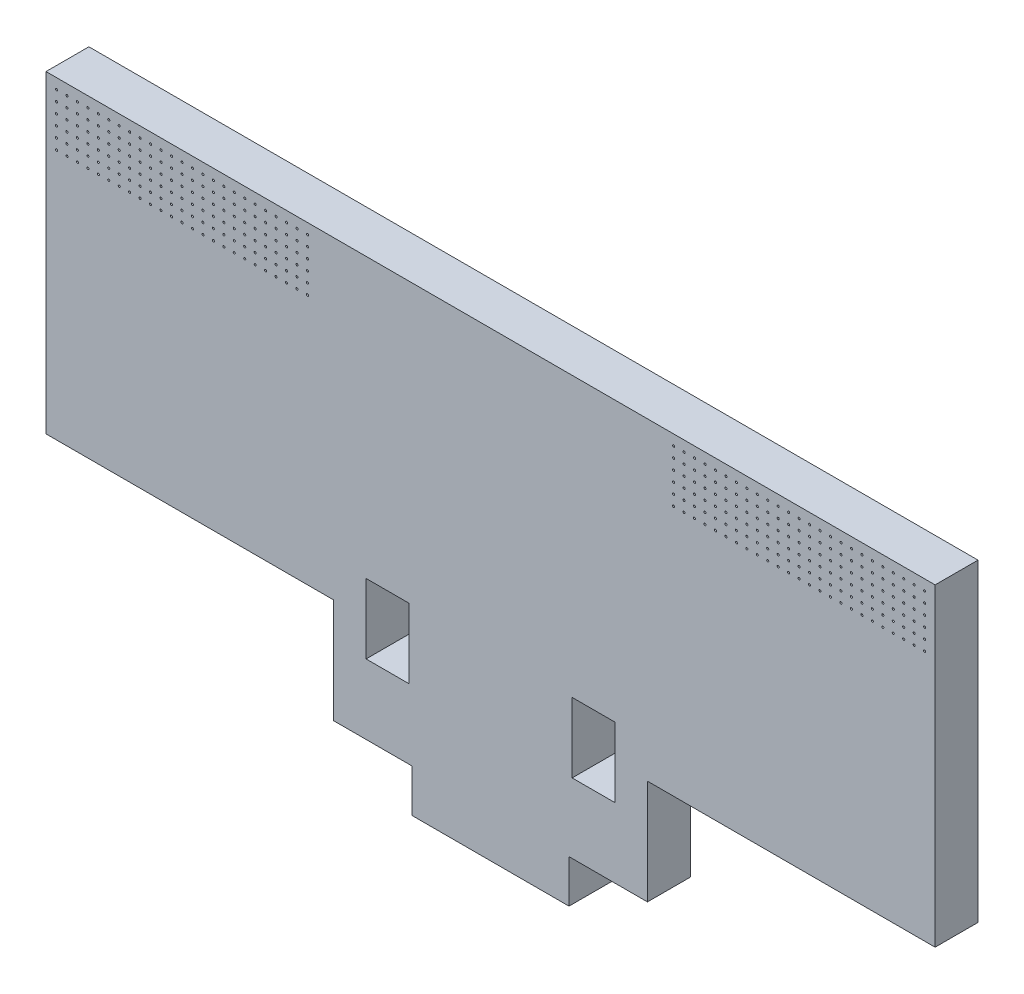
from build123d import *

# Parameters (mm, degrees)
BOSS_EXTRUDE1_DEPTH = 5.207
SKETCH2_R           = 0.127
CUT_EXTRUDE1_DEPTH  = 120.419241955
CAVITY1_START       = 8.466666667
CAVITY1_OUTLINE_W   = 5.207
CAVITY1_OUTLINE_H   = 5.207
CAVITY1_DEPTH       = 8.466666666
SKETCH3_W           = 34.925
SKETCH3_H           = 12.7
CUT_EXTRUDE2_DEPTH  = 120.419241955


# Read off the part's stored shape, not the designer's step: Cavity1
with BuildPart() as part:
    # Sketch1 → Boss-Extrude1 (new body)
    with BuildSketch(Plane.XY):
        Polygon((63.5, 0), (107.95, 0), (107.95, 50.8), (0, 50.8), (0, 0), (44.45, 0), (44.45, -5.207), (63.5, -5.207), align=None)
    extrude(amount=BOSS_EXTRUDE1_DEPTH)

    # Sketch2 → Cut-Extrude1 (cut, through all)
    with BuildSketch(Plane.XY.offset(5.207)):
        with Locations((106.68, 49.53)):
            Circle(SKETCH2_R)
        with Locations((105.41, 49.53)):
            Circle(SKETCH2_R)
        with Locations((104.14, 49.53)):
            Circle(SKETCH2_R)
        with Locations((102.87, 49.53)):
            Circle(SKETCH2_R)
        with Locations((101.6, 49.53)):
            Circle(SKETCH2_R)
        with Locations((100.33, 49.53)):
            Circle(SKETCH2_R)
        with Locations((99.06, 49.53)):
            Circle(SKETCH2_R)
        with Locations((97.79, 49.53)):
            Circle(SKETCH2_R)
        with Locations((96.52, 49.53)):
            Circle(SKETCH2_R)
        with Locations((95.25, 49.53)):
            Circle(SKETCH2_R)
        with Locations((93.98, 49.53)):
            Circle(SKETCH2_R)
        with Locations((92.71, 49.53)):
            Circle(SKETCH2_R)
        with Locations((91.44, 49.53)):
            Circle(SKETCH2_R)
        with Locations((90.17, 49.53)):
            Circle(SKETCH2_R)
        with Locations((88.9, 49.53)):
            Circle(SKETCH2_R)
        with Locations((87.63, 49.53)):
            Circle(SKETCH2_R)
        with Locations((86.36, 49.53)):
            Circle(SKETCH2_R)
        with Locations((85.09, 49.53)):
            Circle(SKETCH2_R)
        with Locations((83.82, 49.53)):
            Circle(SKETCH2_R)
        with Locations((82.55, 49.53)):
            Circle(SKETCH2_R)
        with Locations((81.28, 49.53)):
            Circle(SKETCH2_R)
        with Locations((80.01, 49.53)):
            Circle(SKETCH2_R)
        with Locations((78.74, 49.53)):
            Circle(SKETCH2_R)
        with Locations((77.47, 49.53)):
            Circle(SKETCH2_R)
        with Locations((76.2, 49.53)):
            Circle(SKETCH2_R)
        with Locations((105.41, 48.26)):
            Circle(SKETCH2_R)
        with Locations((104.14, 48.26)):
            Circle(SKETCH2_R)
        with Locations((102.87, 48.26)):
            Circle(SKETCH2_R)
        with Locations((101.6, 48.26)):
            Circle(SKETCH2_R)
        with Locations((100.33, 48.26)):
            Circle(SKETCH2_R)
        with Locations((99.06, 48.26)):
            Circle(SKETCH2_R)
        with Locations((97.79, 48.26)):
            Circle(SKETCH2_R)
        with Locations((96.52, 48.26)):
            Circle(SKETCH2_R)
        with Locations((95.25, 48.26)):
            Circle(SKETCH2_R)
        with Locations((93.98, 48.26)):
            Circle(SKETCH2_R)
        with Locations((92.71, 48.26)):
            Circle(SKETCH2_R)
        with Locations((91.44, 48.26)):
            Circle(SKETCH2_R)
        with Locations((90.17, 48.26)):
            Circle(SKETCH2_R)
        with Locations((88.9, 48.26)):
            Circle(SKETCH2_R)
        with Locations((87.63, 48.26)):
            Circle(SKETCH2_R)
        with Locations((86.36, 48.26)):
            Circle(SKETCH2_R)
        with Locations((85.09, 48.26)):
            Circle(SKETCH2_R)
        with Locations((83.82, 48.26)):
            Circle(SKETCH2_R)
        with Locations((82.55, 48.26)):
            Circle(SKETCH2_R)
        with Locations((81.28, 48.26)):
            Circle(SKETCH2_R)
        with Locations((80.01, 48.26)):
            Circle(SKETCH2_R)
        with Locations((78.74, 48.26)):
            Circle(SKETCH2_R)
        with Locations((77.47, 48.26)):
            Circle(SKETCH2_R)
        with Locations((76.2, 48.26)):
            Circle(SKETCH2_R)
        with Locations((105.41, 46.99)):
            Circle(SKETCH2_R)
        with Locations((104.14, 46.99)):
            Circle(SKETCH2_R)
        with Locations((102.87, 46.99)):
            Circle(SKETCH2_R)
        with Locations((101.6, 46.99)):
            Circle(SKETCH2_R)
        with Locations((100.33, 46.99)):
            Circle(SKETCH2_R)
        with Locations((99.06, 46.99)):
            Circle(SKETCH2_R)
        with Locations((97.79, 46.99)):
            Circle(SKETCH2_R)
        with Locations((96.52, 46.99)):
            Circle(SKETCH2_R)
        with Locations((95.25, 46.99)):
            Circle(SKETCH2_R)
        with Locations((93.98, 46.99)):
            Circle(SKETCH2_R)
        with Locations((92.71, 46.99)):
            Circle(SKETCH2_R)
        with Locations((91.44, 46.99)):
            Circle(SKETCH2_R)
        with Locations((90.17, 46.99)):
            Circle(SKETCH2_R)
        with Locations((88.9, 46.99)):
            Circle(SKETCH2_R)
        with Locations((87.63, 46.99)):
            Circle(SKETCH2_R)
        with Locations((86.36, 46.99)):
            Circle(SKETCH2_R)
        with Locations((85.09, 46.99)):
            Circle(SKETCH2_R)
        with Locations((83.82, 46.99)):
            Circle(SKETCH2_R)
        with Locations((82.55, 46.99)):
            Circle(SKETCH2_R)
        with Locations((81.28, 46.99)):
            Circle(SKETCH2_R)
        with Locations((80.01, 46.99)):
            Circle(SKETCH2_R)
        with Locations((78.74, 46.99)):
            Circle(SKETCH2_R)
        with Locations((77.47, 46.99)):
            Circle(SKETCH2_R)
        with Locations((76.2, 46.99)):
            Circle(SKETCH2_R)
        with Locations((105.41, 45.72)):
            Circle(SKETCH2_R)
        with Locations((104.14, 45.72)):
            Circle(SKETCH2_R)
        with Locations((102.87, 45.72)):
            Circle(SKETCH2_R)
        with Locations((101.6, 45.72)):
            Circle(SKETCH2_R)
        with Locations((100.33, 45.72)):
            Circle(SKETCH2_R)
        with Locations((99.06, 45.72)):
            Circle(SKETCH2_R)
        with Locations((97.79, 45.72)):
            Circle(SKETCH2_R)
        with Locations((96.52, 45.72)):
            Circle(SKETCH2_R)
        with Locations((95.25, 45.72)):
            Circle(SKETCH2_R)
        with Locations((93.98, 45.72)):
            Circle(SKETCH2_R)
        with Locations((92.71, 45.72)):
            Circle(SKETCH2_R)
        with Locations((91.44, 45.72)):
            Circle(SKETCH2_R)
        with Locations((90.17, 45.72)):
            Circle(SKETCH2_R)
        with Locations((88.9, 45.72)):
            Circle(SKETCH2_R)
        with Locations((87.63, 45.72)):
            Circle(SKETCH2_R)
        with Locations((86.36, 45.72)):
            Circle(SKETCH2_R)
        with Locations((85.09, 45.72)):
            Circle(SKETCH2_R)
        with Locations((83.82, 45.72)):
            Circle(SKETCH2_R)
        with Locations((82.55, 45.72)):
            Circle(SKETCH2_R)
        with Locations((81.28, 45.72)):
            Circle(SKETCH2_R)
        with Locations((80.01, 45.72)):
            Circle(SKETCH2_R)
        with Locations((78.74, 45.72)):
            Circle(SKETCH2_R)
        with Locations((77.47, 45.72)):
            Circle(SKETCH2_R)
        with Locations((76.2, 45.72)):
            Circle(SKETCH2_R)
        with Locations((105.41, 44.45)):
            Circle(SKETCH2_R)
        with Locations((104.14, 44.45)):
            Circle(SKETCH2_R)
        with Locations((102.87, 44.45)):
            Circle(SKETCH2_R)
        with Locations((101.6, 44.45)):
            Circle(SKETCH2_R)
        with Locations((100.33, 44.45)):
            Circle(SKETCH2_R)
        with Locations((99.06, 44.45)):
            Circle(SKETCH2_R)
        with Locations((97.79, 44.45)):
            Circle(SKETCH2_R)
        with Locations((96.52, 44.45)):
            Circle(SKETCH2_R)
        with Locations((95.25, 44.45)):
            Circle(SKETCH2_R)
        with Locations((93.98, 44.45)):
            Circle(SKETCH2_R)
        with Locations((92.71, 44.45)):
            Circle(SKETCH2_R)
        with Locations((91.44, 44.45)):
            Circle(SKETCH2_R)
        with Locations((90.17, 44.45)):
            Circle(SKETCH2_R)
        with Locations((88.9, 44.45)):
            Circle(SKETCH2_R)
        with Locations((87.63, 44.45)):
            Circle(SKETCH2_R)
        with Locations((86.36, 44.45)):
            Circle(SKETCH2_R)
        with Locations((85.09, 44.45)):
            Circle(SKETCH2_R)
        with Locations((83.82, 44.45)):
            Circle(SKETCH2_R)
        with Locations((82.55, 44.45)):
            Circle(SKETCH2_R)
        with Locations((81.28, 44.45)):
            Circle(SKETCH2_R)
        with Locations((80.01, 44.45)):
            Circle(SKETCH2_R)
        with Locations((78.74, 44.45)):
            Circle(SKETCH2_R)
        with Locations((77.47, 44.45)):
            Circle(SKETCH2_R)
        with Locations((76.2, 44.45)):
            Circle(SKETCH2_R)
        with Locations((105.41, 43.18)):
            Circle(SKETCH2_R)
        with Locations((104.14, 43.18)):
            Circle(SKETCH2_R)
        with Locations((102.87, 43.18)):
            Circle(SKETCH2_R)
        with Locations((101.6, 43.18)):
            Circle(SKETCH2_R)
        with Locations((100.33, 43.18)):
            Circle(SKETCH2_R)
        with Locations((99.06, 43.18)):
            Circle(SKETCH2_R)
        with Locations((97.79, 43.18)):
            Circle(SKETCH2_R)
        with Locations((96.52, 43.18)):
            Circle(SKETCH2_R)
        with Locations((95.25, 43.18)):
            Circle(SKETCH2_R)
        with Locations((93.98, 43.18)):
            Circle(SKETCH2_R)
        with Locations((92.71, 43.18)):
            Circle(SKETCH2_R)
        with Locations((91.44, 43.18)):
            Circle(SKETCH2_R)
        with Locations((90.17, 43.18)):
            Circle(SKETCH2_R)
        with Locations((88.9, 43.18)):
            Circle(SKETCH2_R)
        with Locations((87.63, 43.18)):
            Circle(SKETCH2_R)
        with Locations((86.36, 43.18)):
            Circle(SKETCH2_R)
        with Locations((85.09, 43.18)):
            Circle(SKETCH2_R)
        with Locations((83.82, 43.18)):
            Circle(SKETCH2_R)
        with Locations((82.55, 43.18)):
            Circle(SKETCH2_R)
        with Locations((81.28, 43.18)):
            Circle(SKETCH2_R)
        with Locations((80.01, 43.18)):
            Circle(SKETCH2_R)
        with Locations((78.74, 43.18)):
            Circle(SKETCH2_R)
        with Locations((77.47, 43.18)):
            Circle(SKETCH2_R)
        with Locations((76.2, 43.18)):
            Circle(SKETCH2_R)
        with Locations((106.68, 48.26)):
            Circle(SKETCH2_R)
        with Locations((106.68, 46.99)):
            Circle(SKETCH2_R)
        with Locations((106.68, 45.72)):
            Circle(SKETCH2_R)
        with Locations((106.68, 44.45)):
            Circle(SKETCH2_R)
        with Locations((106.68, 43.18)):
            Circle(SKETCH2_R)
        with Locations(Location((1.27, 43.18, 0), (0, 0, 180))):
            Circle(SKETCH2_R)
        with Locations(Location((1.27, 44.45, 0), (0, 0, 180))):
            Circle(SKETCH2_R)
        with Locations(Location((1.27, 45.72, 0), (0, 0, 180))):
            Circle(SKETCH2_R)
        with Locations(Location((1.27, 46.99, 0), (0, 0, 180))):
            Circle(SKETCH2_R)
        with Locations(Location((1.27, 48.26, 0), (0, 0, 180))):
            Circle(SKETCH2_R)
        with Locations(Location((31.75, 43.18, 0), (0, 0, 180))):
            Circle(SKETCH2_R)
        with Locations(Location((30.48, 43.18, 0), (0, 0, 180))):
            Circle(SKETCH2_R)
        with Locations(Location((29.21, 43.18, 0), (0, 0, 180))):
            Circle(SKETCH2_R)
        with Locations(Location((27.94, 43.18, 0), (0, 0, 180))):
            Circle(SKETCH2_R)
        with Locations(Location((26.67, 43.18, 0), (0, 0, 180))):
            Circle(SKETCH2_R)
        with Locations(Location((25.4, 43.18, 0), (0, 0, 180))):
            Circle(SKETCH2_R)
        with Locations(Location((24.13, 43.18, 0), (0, 0, 180))):
            Circle(SKETCH2_R)
        with Locations(Location((22.86, 43.18, 0), (0, 0, 180))):
            Circle(SKETCH2_R)
        with Locations(Location((21.59, 43.18, 0), (0, 0, 180))):
            Circle(SKETCH2_R)
        with Locations(Location((20.32, 43.18, 0), (0, 0, 180))):
            Circle(SKETCH2_R)
        with Locations(Location((19.05, 43.18, 0), (0, 0, 180))):
            Circle(SKETCH2_R)
        with Locations(Location((17.78, 43.18, 0), (0, 0, 180))):
            Circle(SKETCH2_R)
        with Locations(Location((16.51, 43.18, 0), (0, 0, 180))):
            Circle(SKETCH2_R)
        with Locations(Location((15.24, 43.18, 0), (0, 0, 180))):
            Circle(SKETCH2_R)
        with Locations(Location((13.97, 43.18, 0), (0, 0, 180))):
            Circle(SKETCH2_R)
        with Locations(Location((12.7, 43.18, 0), (0, 0, 180))):
            Circle(SKETCH2_R)
        with Locations(Location((11.43, 43.18, 0), (0, 0, 180))):
            Circle(SKETCH2_R)
        with Locations(Location((10.16, 43.18, 0), (0, 0, 180))):
            Circle(SKETCH2_R)
        with Locations(Location((8.89, 43.18, 0), (0, 0, 180))):
            Circle(SKETCH2_R)
        with Locations(Location((7.62, 43.18, 0), (0, 0, 180))):
            Circle(SKETCH2_R)
        with Locations(Location((6.35, 43.18, 0), (0, 0, 180))):
            Circle(SKETCH2_R)
        with Locations(Location((5.08, 43.18, 0), (0, 0, 180))):
            Circle(SKETCH2_R)
        with Locations(Location((3.81, 43.18, 0), (0, 0, 180))):
            Circle(SKETCH2_R)
        with Locations(Location((2.54, 43.18, 0), (0, 0, 180))):
            Circle(SKETCH2_R)
        with Locations(Location((31.75, 44.45, 0), (0, 0, 180))):
            Circle(SKETCH2_R)
        with Locations(Location((30.48, 44.45, 0), (0, 0, 180))):
            Circle(SKETCH2_R)
        with Locations(Location((29.21, 44.45, 0), (0, 0, 180))):
            Circle(SKETCH2_R)
        with Locations(Location((27.94, 44.45, 0), (0, 0, 180))):
            Circle(SKETCH2_R)
        with Locations(Location((26.67, 44.45, 0), (0, 0, 180))):
            Circle(SKETCH2_R)
        with Locations(Location((25.4, 44.45, 0), (0, 0, 180))):
            Circle(SKETCH2_R)
        with Locations(Location((24.13, 44.45, 0), (0, 0, 180))):
            Circle(SKETCH2_R)
        with Locations(Location((22.86, 44.45, 0), (0, 0, 180))):
            Circle(SKETCH2_R)
        with Locations(Location((21.59, 44.45, 0), (0, 0, 180))):
            Circle(SKETCH2_R)
        with Locations(Location((20.32, 44.45, 0), (0, 0, 180))):
            Circle(SKETCH2_R)
        with Locations(Location((19.05, 44.45, 0), (0, 0, 180))):
            Circle(SKETCH2_R)
        with Locations(Location((17.78, 44.45, 0), (0, 0, 180))):
            Circle(SKETCH2_R)
        with Locations(Location((16.51, 44.45, 0), (0, 0, 180))):
            Circle(SKETCH2_R)
        with Locations(Location((15.24, 44.45, 0), (0, 0, 180))):
            Circle(SKETCH2_R)
        with Locations(Location((13.97, 44.45, 0), (0, 0, 180))):
            Circle(SKETCH2_R)
        with Locations(Location((12.7, 44.45, 0), (0, 0, 180))):
            Circle(SKETCH2_R)
        with Locations(Location((11.43, 44.45, 0), (0, 0, 180))):
            Circle(SKETCH2_R)
        with Locations(Location((10.16, 44.45, 0), (0, 0, 180))):
            Circle(SKETCH2_R)
        with Locations(Location((8.89, 44.45, 0), (0, 0, 180))):
            Circle(SKETCH2_R)
        with Locations(Location((7.62, 44.45, 0), (0, 0, 180))):
            Circle(SKETCH2_R)
        with Locations(Location((6.35, 44.45, 0), (0, 0, 180))):
            Circle(SKETCH2_R)
        with Locations(Location((5.08, 44.45, 0), (0, 0, 180))):
            Circle(SKETCH2_R)
        with Locations(Location((3.81, 44.45, 0), (0, 0, 180))):
            Circle(SKETCH2_R)
        with Locations(Location((2.54, 44.45, 0), (0, 0, 180))):
            Circle(SKETCH2_R)
        with Locations(Location((31.75, 45.72, 0), (0, 0, 180))):
            Circle(SKETCH2_R)
        with Locations(Location((30.48, 45.72, 0), (0, 0, 180))):
            Circle(SKETCH2_R)
        with Locations(Location((29.21, 45.72, 0), (0, 0, 180))):
            Circle(SKETCH2_R)
        with Locations(Location((27.94, 45.72, 0), (0, 0, 180))):
            Circle(SKETCH2_R)
        with Locations(Location((26.67, 45.72, 0), (0, 0, 180))):
            Circle(SKETCH2_R)
        with Locations(Location((25.4, 45.72, 0), (0, 0, 180))):
            Circle(SKETCH2_R)
        with Locations(Location((24.13, 45.72, 0), (0, 0, 180))):
            Circle(SKETCH2_R)
        with Locations(Location((22.86, 45.72, 0), (0, 0, 180))):
            Circle(SKETCH2_R)
        with Locations(Location((21.59, 45.72, 0), (0, 0, 180))):
            Circle(SKETCH2_R)
        with Locations(Location((20.32, 45.72, 0), (0, 0, 180))):
            Circle(SKETCH2_R)
        with Locations(Location((19.05, 45.72, 0), (0, 0, 180))):
            Circle(SKETCH2_R)
        with Locations(Location((17.78, 45.72, 0), (0, 0, 180))):
            Circle(SKETCH2_R)
        with Locations(Location((16.51, 45.72, 0), (0, 0, 180))):
            Circle(SKETCH2_R)
        with Locations(Location((15.24, 45.72, 0), (0, 0, 180))):
            Circle(SKETCH2_R)
        with Locations(Location((13.97, 45.72, 0), (0, 0, 180))):
            Circle(SKETCH2_R)
        with Locations(Location((12.7, 45.72, 0), (0, 0, 180))):
            Circle(SKETCH2_R)
        with Locations(Location((11.43, 45.72, 0), (0, 0, 180))):
            Circle(SKETCH2_R)
        with Locations(Location((10.16, 45.72, 0), (0, 0, 180))):
            Circle(SKETCH2_R)
        with Locations(Location((8.89, 45.72, 0), (0, 0, 180))):
            Circle(SKETCH2_R)
        with Locations(Location((7.62, 45.72, 0), (0, 0, 180))):
            Circle(SKETCH2_R)
        with Locations(Location((6.35, 45.72, 0), (0, 0, 180))):
            Circle(SKETCH2_R)
        with Locations(Location((5.08, 45.72, 0), (0, 0, 180))):
            Circle(SKETCH2_R)
        with Locations(Location((3.81, 45.72, 0), (0, 0, 180))):
            Circle(SKETCH2_R)
        with Locations(Location((2.54, 45.72, 0), (0, 0, 180))):
            Circle(SKETCH2_R)
        with Locations(Location((31.75, 46.99, 0), (0, 0, 180))):
            Circle(SKETCH2_R)
        with Locations(Location((30.48, 46.99, 0), (0, 0, 180))):
            Circle(SKETCH2_R)
        with Locations(Location((29.21, 46.99, 0), (0, 0, 180))):
            Circle(SKETCH2_R)
        with Locations(Location((27.94, 46.99, 0), (0, 0, 180))):
            Circle(SKETCH2_R)
        with Locations(Location((26.67, 46.99, 0), (0, 0, 180))):
            Circle(SKETCH2_R)
        with Locations(Location((25.4, 46.99, 0), (0, 0, 180))):
            Circle(SKETCH2_R)
        with Locations(Location((24.13, 46.99, 0), (0, 0, 180))):
            Circle(SKETCH2_R)
        with Locations(Location((22.86, 46.99, 0), (0, 0, 180))):
            Circle(SKETCH2_R)
        with Locations(Location((21.59, 46.99, 0), (0, 0, 180))):
            Circle(SKETCH2_R)
        with Locations(Location((20.32, 46.99, 0), (0, 0, 180))):
            Circle(SKETCH2_R)
        with Locations(Location((19.05, 46.99, 0), (0, 0, 180))):
            Circle(SKETCH2_R)
        with Locations(Location((17.78, 46.99, 0), (0, 0, 180))):
            Circle(SKETCH2_R)
        with Locations(Location((16.51, 46.99, 0), (0, 0, 180))):
            Circle(SKETCH2_R)
        with Locations(Location((15.24, 46.99, 0), (0, 0, 180))):
            Circle(SKETCH2_R)
        with Locations(Location((13.97, 46.99, 0), (0, 0, 180))):
            Circle(SKETCH2_R)
        with Locations(Location((12.7, 46.99, 0), (0, 0, 180))):
            Circle(SKETCH2_R)
        with Locations(Location((11.43, 46.99, 0), (0, 0, 180))):
            Circle(SKETCH2_R)
        with Locations(Location((10.16, 46.99, 0), (0, 0, 180))):
            Circle(SKETCH2_R)
        with Locations(Location((8.89, 46.99, 0), (0, 0, 180))):
            Circle(SKETCH2_R)
        with Locations(Location((7.62, 46.99, 0), (0, 0, 180))):
            Circle(SKETCH2_R)
        with Locations(Location((6.35, 46.99, 0), (0, 0, 180))):
            Circle(SKETCH2_R)
        with Locations(Location((5.08, 46.99, 0), (0, 0, 180))):
            Circle(SKETCH2_R)
        with Locations(Location((3.81, 46.99, 0), (0, 0, 180))):
            Circle(SKETCH2_R)
        with Locations(Location((2.54, 46.99, 0), (0, 0, 180))):
            Circle(SKETCH2_R)
        with Locations(Location((31.75, 48.26, 0), (0, 0, 180))):
            Circle(SKETCH2_R)
        with Locations(Location((30.48, 48.26, 0), (0, 0, 180))):
            Circle(SKETCH2_R)
        with Locations(Location((29.21, 48.26, 0), (0, 0, 180))):
            Circle(SKETCH2_R)
        with Locations(Location((27.94, 48.26, 0), (0, 0, 180))):
            Circle(SKETCH2_R)
        with Locations(Location((26.67, 48.26, 0), (0, 0, 180))):
            Circle(SKETCH2_R)
        with Locations(Location((25.4, 48.26, 0), (0, 0, 180))):
            Circle(SKETCH2_R)
        with Locations(Location((24.13, 48.26, 0), (0, 0, 180))):
            Circle(SKETCH2_R)
        with Locations(Location((22.86, 48.26, 0), (0, 0, 180))):
            Circle(SKETCH2_R)
        with Locations(Location((21.59, 48.26, 0), (0, 0, 180))):
            Circle(SKETCH2_R)
        with Locations(Location((20.32, 48.26, 0), (0, 0, 180))):
            Circle(SKETCH2_R)
        with Locations(Location((19.05, 48.26, 0), (0, 0, 180))):
            Circle(SKETCH2_R)
        with Locations(Location((17.78, 48.26, 0), (0, 0, 180))):
            Circle(SKETCH2_R)
        with Locations(Location((16.51, 48.26, 0), (0, 0, 180))):
            Circle(SKETCH2_R)
        with Locations(Location((15.24, 48.26, 0), (0, 0, 180))):
            Circle(SKETCH2_R)
        with Locations(Location((13.97, 48.26, 0), (0, 0, 180))):
            Circle(SKETCH2_R)
        with Locations(Location((12.7, 48.26, 0), (0, 0, 180))):
            Circle(SKETCH2_R)
        with Locations(Location((11.43, 48.26, 0), (0, 0, 180))):
            Circle(SKETCH2_R)
        with Locations(Location((10.16, 48.26, 0), (0, 0, 180))):
            Circle(SKETCH2_R)
        with Locations(Location((8.89, 48.26, 0), (0, 0, 180))):
            Circle(SKETCH2_R)
        with Locations(Location((7.62, 48.26, 0), (0, 0, 180))):
            Circle(SKETCH2_R)
        with Locations(Location((6.35, 48.26, 0), (0, 0, 180))):
            Circle(SKETCH2_R)
        with Locations(Location((5.08, 48.26, 0), (0, 0, 180))):
            Circle(SKETCH2_R)
        with Locations(Location((3.81, 48.26, 0), (0, 0, 180))):
            Circle(SKETCH2_R)
        with Locations(Location((2.54, 48.26, 0), (0, 0, 180))):
            Circle(SKETCH2_R)
        with Locations(Location((31.75, 49.53, 0), (0, 0, 180))):
            Circle(SKETCH2_R)
        with Locations(Location((30.48, 49.53, 0), (0, 0, 180))):
            Circle(SKETCH2_R)
        with Locations(Location((29.21, 49.53, 0), (0, 0, 180))):
            Circle(SKETCH2_R)
        with Locations(Location((27.94, 49.53, 0), (0, 0, 180))):
            Circle(SKETCH2_R)
        with Locations(Location((26.67, 49.53, 0), (0, 0, 180))):
            Circle(SKETCH2_R)
        with Locations(Location((25.4, 49.53, 0), (0, 0, 180))):
            Circle(SKETCH2_R)
        with Locations(Location((24.13, 49.53, 0), (0, 0, 180))):
            Circle(SKETCH2_R)
        with Locations(Location((22.86, 49.53, 0), (0, 0, 180))):
            Circle(SKETCH2_R)
        with Locations(Location((21.59, 49.53, 0), (0, 0, 180))):
            Circle(SKETCH2_R)
        with Locations(Location((20.32, 49.53, 0), (0, 0, 180))):
            Circle(SKETCH2_R)
        with Locations(Location((19.05, 49.53, 0), (0, 0, 180))):
            Circle(SKETCH2_R)
        with Locations(Location((17.78, 49.53, 0), (0, 0, 180))):
            Circle(SKETCH2_R)
        with Locations(Location((16.51, 49.53, 0), (0, 0, 180))):
            Circle(SKETCH2_R)
        with Locations(Location((15.24, 49.53, 0), (0, 0, 180))):
            Circle(SKETCH2_R)
        with Locations(Location((13.97, 49.53, 0), (0, 0, 180))):
            Circle(SKETCH2_R)
        with Locations(Location((12.7, 49.53, 0), (0, 0, 180))):
            Circle(SKETCH2_R)
        with Locations(Location((11.43, 49.53, 0), (0, 0, 180))):
            Circle(SKETCH2_R)
        with Locations(Location((10.16, 49.53, 0), (0, 0, 180))):
            Circle(SKETCH2_R)
        with Locations(Location((8.89, 49.53, 0), (0, 0, 180))):
            Circle(SKETCH2_R)
        with Locations(Location((7.62, 49.53, 0), (0, 0, 180))):
            Circle(SKETCH2_R)
        with Locations(Location((6.35, 49.53, 0), (0, 0, 180))):
            Circle(SKETCH2_R)
        with Locations(Location((5.08, 49.53, 0), (0, 0, 180))):
            Circle(SKETCH2_R)
        with Locations(Location((3.81, 49.53, 0), (0, 0, 180))):
            Circle(SKETCH2_R)
        with Locations(Location((2.54, 49.53, 0), (0, 0, 180))):
            Circle(SKETCH2_R)
        with Locations(Location((1.27, 49.53, 0), (0, 0, 180))):
            Circle(SKETCH2_R)
    extrude(amount=-CUT_EXTRUDE1_DEPTH, mode=Mode.SUBTRACT)

    # Cavity1 outline → Cavity1 (cut)
    with BuildSketch(Plane(origin=(0, 0, 0), x_dir=(1, 0, 0), z_dir=(0, 1, 0)).offset(CAVITY1_START)):
        with Locations((41.4655, -2.6035)):
            Rectangle(CAVITY1_OUTLINE_W, CAVITY1_OUTLINE_H)
        with Locations((66.4845, -2.6035)):
            Rectangle(CAVITY1_OUTLINE_W, CAVITY1_OUTLINE_H)
    extrude(amount=CAVITY1_DEPTH, mode=Mode.SUBTRACT)

    # Sketch3 → Cut-Extrude2 (cut, through all)
    with BuildSketch(Plane.XY.offset(5.207)):
        with Locations((17.4625, 6.35)):
            Rectangle(SKETCH3_W, SKETCH3_H)
        with Locations((90.4875, 6.35)):
            Rectangle(SKETCH3_W, SKETCH3_H)
    extrude(amount=-CUT_EXTRUDE2_DEPTH, mode=Mode.SUBTRACT)


solid = part.part
